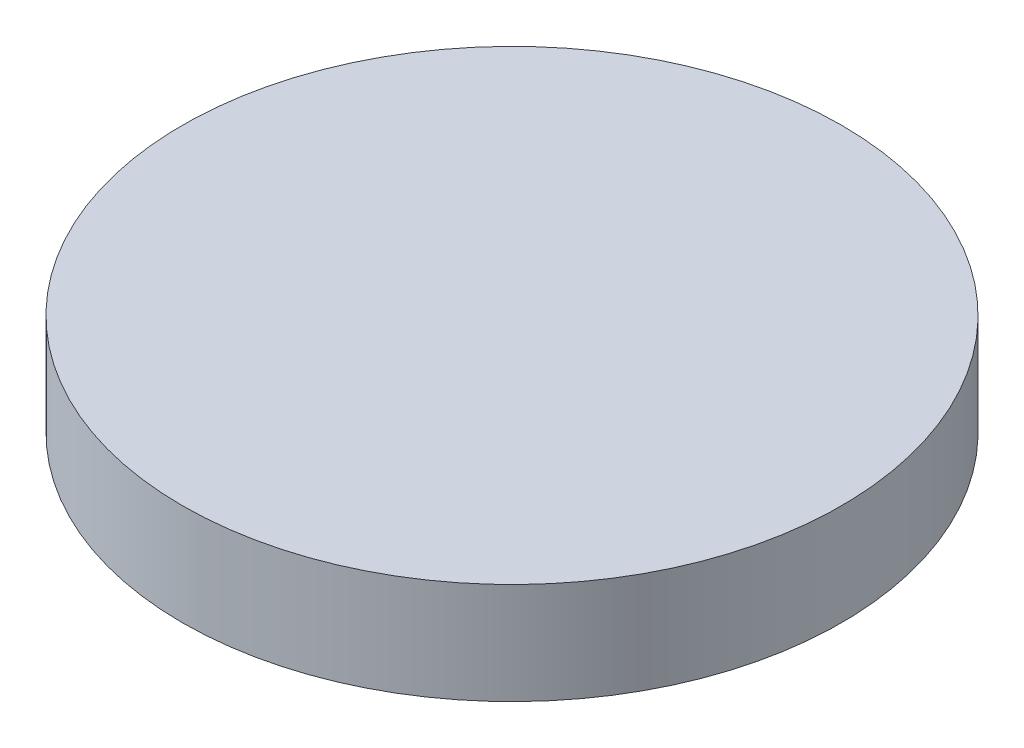
from build123d import *

# Parameters (mm, degrees)
CROQUIS1_R              = 13
SALIENTE_EXTRUIR1_DEPTH = 4
CROQUIS2_R              = 3.5
CORTAR_EXTRUIR1_DEPTH   = 0.5


with BuildPart() as part:
    # Croquis1 → Saliente-Extruir1 (new body)
    with BuildSketch(Plane(origin=(0, 0, 0), x_dir=(1, 0, 0), z_dir=(0, 1, 0))):
        Circle(CROQUIS1_R)
    extrude(amount=SALIENTE_EXTRUIR1_DEPTH)

    # Croquis2 → Cortar-Extruir1 (cut)
    with BuildSketch(Plane.XZ):
        Circle(CROQUIS2_R)
    extrude(amount=-CORTAR_EXTRUIR1_DEPTH, mode=Mode.SUBTRACT)


solid = part.part
